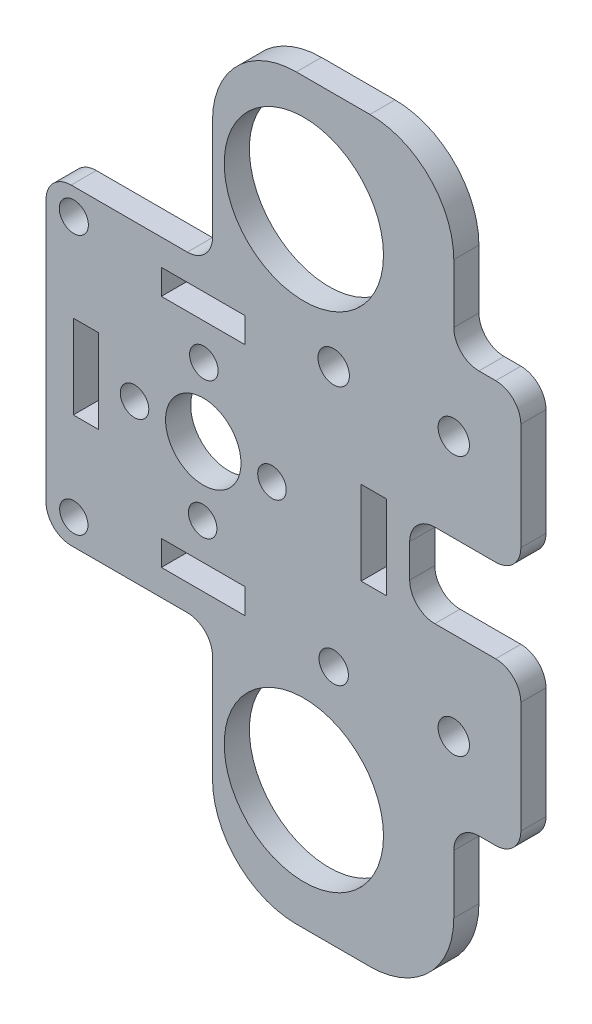
from build123d import *

# Parameters (mm, degrees)
SKETCH1_R           = 1.737885662
SKETCH1_R_2         = 1.873200063
SKETCH1_R_3         = 1.690089146
SKETCH1_R_4         = 1.754205974
SKETCH1_R_5         = 1.7
SKETCH1_R_6         = 4.5
SKETCH1_R_7         = 1.87
SKETCH1_R_8         = 9.5
SKETCH1_W           = 3
SKETCH1_H           = 10
SKETCH1_W_2         = 10
SKETCH1_H_2         = 3
BOSS_EXTRUDE1_DEPTH = 3
FILLET1_R           = 10
FILLET2_R           = 3


with BuildPart() as part:
    # Sketch1 → Boss-Extrude1 (new body)
    with BuildSketch(Plane.XY):
        Polygon((147.061964125, -92.970138098), (147.061964125, -71.856515964), (147.061964125, -67.856515964), (175.843347401, -67.856515964), (175.843347401, -87.856515964), (183.843347401, -87.856515964), (183.843347401, -106.620435009), (170.582125914, -106.620435009), (170.582125914, -116.591712302), (183.843347401, -116.591712302), (183.843347401, -135.887076434), (175.843347401, -135.887076434), (175.843347401, -155.887076434), (147.061964125, -155.887076434), (147.061964125, -151.887076434), (147.061964125, -130.215533927), (127.203791419, -130.215533927), (127.203791419, -111.591712302), (127.203791419, -92.970138098), align=None)
        with Locations((130.520049527, -96.082032258)):
            Circle(SKETCH1_R, mode=Mode.SUBTRACT)
        with Locations((161.520049527, -96.082032258)):
            Circle(SKETCH1_R_2, mode=Mode.SUBTRACT)
        with Locations((130.520049527, -127.114221831)):
            Circle(SKETCH1_R_3, mode=Mode.SUBTRACT)
        with Locations((161.520049527, -127.082032258)):
            Circle(SKETCH1_R_4, mode=Mode.SUBTRACT)
        with Locations((154.157584865, -111.662272701)):
            Circle(SKETCH1_R_5, mode=Mode.SUBTRACT)
        with Locations((145.89014032, -119.788596448)):
            Circle(SKETCH1_R_5, mode=Mode.SUBTRACT)
        with Locations((137.763816574, -111.521151903)):
            Circle(SKETCH1_R_5, mode=Mode.SUBTRACT)
        with Locations((146.031261118, -103.394828157)):
            Circle(SKETCH1_R_5, mode=Mode.SUBTRACT)
        with Locations((145.960700719, -111.591712302)):
            Circle(SKETCH1_R_6, mode=Mode.SUBTRACT)
        with Locations((175.843347401, -96.114221831)):
            Circle(SKETCH1_R_7, mode=Mode.SUBTRACT)
        with Locations((157.960700719, -81.591712302)):
            Circle(SKETCH1_R_8, mode=Mode.SUBTRACT)
        with Locations((157.960700719, -141.591712302)):
            Circle(SKETCH1_R_8, mode=Mode.SUBTRACT)
        with Locations((175.843347401, -127.114221831)):
            Circle(SKETCH1_R_7, mode=Mode.SUBTRACT)
        with Locations((131.960700719, -111.591712302)):
            Rectangle(SKETCH1_W, SKETCH1_H, mode=Mode.SUBTRACT)
        with Locations((145.960700719, -97.591712302)):
            Rectangle(SKETCH1_W_2, SKETCH1_H_2, mode=Mode.SUBTRACT)
        with Locations((145.960700719, -125.591712302)):
            Rectangle(SKETCH1_W_2, SKETCH1_H_2, mode=Mode.SUBTRACT)
        with Locations((166.293610901, -111.591712302)):
            Rectangle(SKETCH1_W, SKETCH1_H, mode=Mode.SUBTRACT)
    extrude(amount=BOSS_EXTRUDE1_DEPTH)

    # Fillet1
    fillet1_edges = [part.edges().sort_by_distance(p)[0] for p in [
        (175.843347401, -155.887076434, 1.5),
        (147.061964125, -155.887076434, 1.5),
        (147.061964125, -67.856515964, 1.5),
        (175.843347401, -67.856515964, 1.5),
    ]]
    fillet(fillet1_edges, radius=FILLET1_R)

    # Fillet2
    fillet2_edges = [part.edges().sort_by_distance(p)[0] for p in [
        (183.843347401, -106.620435009, 1.5),
        (183.843347401, -116.591712302, 1.5),
        (183.843347401, -87.856515964, 1.5),
        (183.843347401, -135.887076434, 1.5),
        (175.843347401, -135.887076434, 1.5),
        (175.843347401, -87.856515964, 1.5),
        (170.582125914, -116.591712302, 1.5),
        (170.582125914, -106.620435009, 1.5),
        (127.203791419, -92.970138098, 1.5),
        (147.061964125, -92.970138098, 1.5),
        (147.061964125, -130.215533927, 1.5),
        (127.203791419, -130.215533927, 1.5),
    ]]
    fillet(fillet2_edges, radius=FILLET2_R)


solid = part.part
